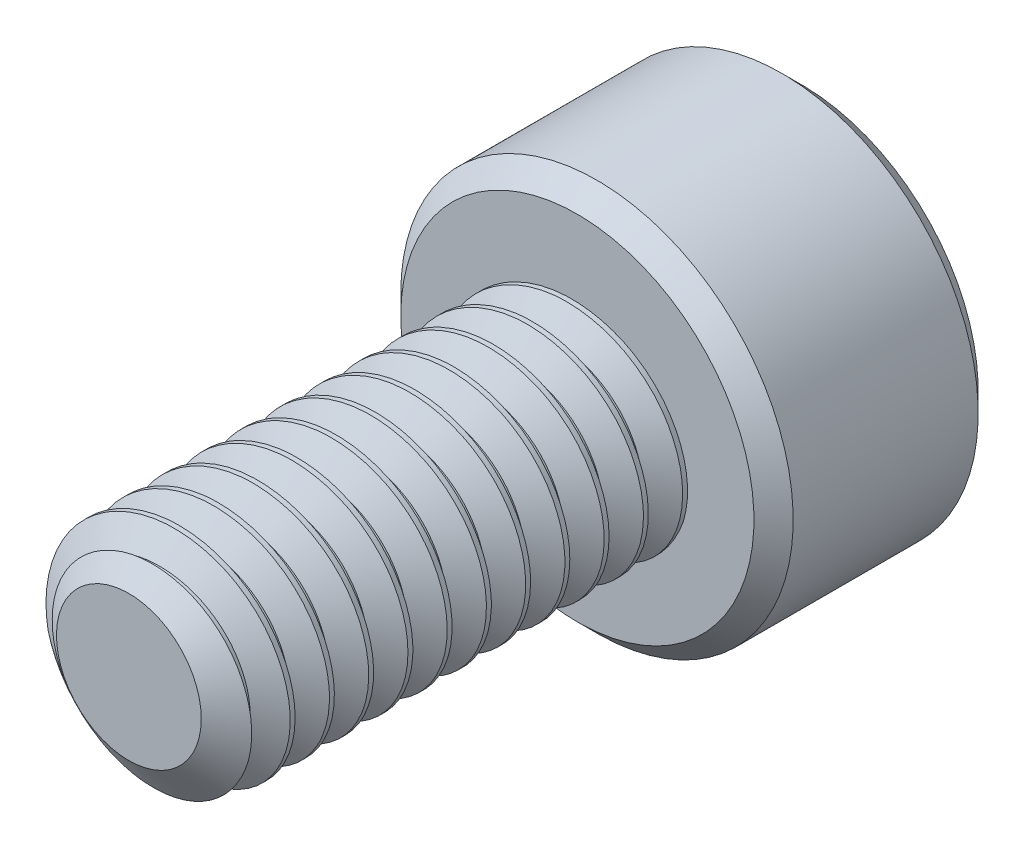
from build123d import *

# Parameters (mm, degrees)
SKETCH1_R          = 2
EXTRUDE1_DEPTH     = 8
CUT_SWEEP1_PITCH   = 0.7
SKETCH6_R          = 3.5
EXTRUDE2_DEPTH     = 4
CUT_EXTRUDE1_DEPTH = 2.25
CHAMFER1_SIZE      = 0.35


with BuildPart() as part:
    # Sketch1 → Extrude1 (new body)
    with BuildSketch(Plane.XY):
        Circle(SKETCH1_R)
    extrude(amount=-EXTRUDE1_DEPTH)

    # Cut-Sweep1: the profile of Sketch3 profile screwed along a right-hand helix of 12.428571 turns, 6 arcs to a turn; built about Z, then put on its axis
    cut_sweep1_z = Axis((0, 0, 0), (0, 0, 1))
    cut_sweep1_corners = [(2.0003, 0, -0.612673205), (1.545336663, 0, -0.35), (1.545336663, 0, -0.2625), (2.0003, 0, 0.000173205)]
    with BuildLine(mode=Mode.PRIVATE) as cut_sweep1_profile:
        Line(cut_sweep1_corners[0], cut_sweep1_corners[1])
        Line(cut_sweep1_corners[1], cut_sweep1_corners[2])
        Line(cut_sweep1_corners[2], cut_sweep1_corners[3])
        Line(cut_sweep1_corners[3], cut_sweep1_corners[0])
    cut_sweep1_cap = Face(cut_sweep1_profile.wire())
    cut_sweep1_turn_angles = [0, 30, 60, 90, 120, 150, 180, 210, 240, 270, 300, 330, 360]
    cut_sweep1_turn_weights = [1, 0.8660254037844387, 1, 0.8660254037844387, 1, 0.8660254037844387, 1, 0.8660254037844387, 1, 0.8660254037844387, 1, 0.8660254037844387, 1]
    cut_sweep1_turn_rails = [Edge.make_bspline([Vector(p[0], p[1], 0).rotate(cut_sweep1_z, cut_sweep1_turn_angles[k]) / cut_sweep1_turn_weights[k] + Vector(0, 0, p[2] + CUT_SWEEP1_PITCH * cut_sweep1_turn_angles[k] / 360) for k in range(13)], [0, 0, 0, 1, 1, 2, 2, 3, 3, 4, 4, 5, 5, 6, 6, 6], 2, cut_sweep1_turn_weights) for p in cut_sweep1_corners]
    cut_sweep1_turn_sides = [Face.make_surface_from_curves(cut_sweep1_turn_rails[p[0]], cut_sweep1_turn_rails[p[1]]) for p in [(0, 1), (1, 2), (2, 3), (3, 0)]]
    cut_sweep1_last_angles = [4320, 4350, 4380, 4410, 4440, 4457.142857143, 4474.285714286]
    cut_sweep1_last_weights = [1, 0.8660254037844387, 1, 0.8660254037844387, 1, 0.9555728057861561, 1]
    cut_sweep1_last_rails = [Edge.make_bspline([Vector(p[0], p[1], 0).rotate(cut_sweep1_z, cut_sweep1_last_angles[k]) / cut_sweep1_last_weights[k] + Vector(0, 0, p[2] + CUT_SWEEP1_PITCH * cut_sweep1_last_angles[k] / 360) for k in range(7)], [0, 0, 0, 1, 1, 2, 2, 3, 3, 3], 2, cut_sweep1_last_weights) for p in cut_sweep1_corners]
    cut_sweep1_last_sides = [Face.make_surface_from_curves(cut_sweep1_last_rails[p[0]], cut_sweep1_last_rails[p[1]]) for p in [(0, 1), (1, 2), (2, 3), (3, 0)]]
    cut_sweep1 = Plane(origin=(0, 0, 0), x_dir=(0, 1, 0), z_dir=(0, 0, -1)) * Solid(Shell([*[p.moved(Location((0, 0, CUT_SWEEP1_PITCH * i))) for i in range(12) for p in cut_sweep1_turn_sides], *cut_sweep1_last_sides, cut_sweep1_cap, cut_sweep1_cap.rotate(cut_sweep1_z, 4474.285714286).moved(Location((0, 0, CUT_SWEEP1_PITCH * 4474.285714286 / 360)))]))
    add(cut_sweep1, mode=Mode.SUBTRACT)

    # Sketch4 → Cut-Revolve1 (revolve, cut)
    with BuildSketch(Plane(origin=(0, 0, 0), x_dir=(0, 0, -1), z_dir=(1, 0, 0)), mode=Mode.PRIVATE) as cut_revolve1_sk:
        Polygon((0.496211411, 2), (0, 1.291336663), (0, 2), align=None)
    revolve(cut_revolve1_sk.sketch.rotate(Axis((0, 0, 0), (0, 0, -1)), 271.401126896), axis=Axis((0, 0, 0), (0, 0, -1)), mode=Mode.SUBTRACT)

    # Sketch6 → Extrude2 (add)
    with BuildSketch(Plane(origin=(0, 0, -8), x_dir=(-1, 0, 0), z_dir=(0, 0, -1))):
        Circle(SKETCH6_R)
    extrude(amount=EXTRUDE2_DEPTH)

    # Sketch7 → Cut-Extrude1 (cut)
    with BuildSketch(Plane(origin=(0, 0, -12), x_dir=(-1, 0, 0), z_dir=(0, 0, -1))):
        Polygon((0, 1.732050808), (-1.5, 0.866025404), (-1.5, -0.866025404), (0, -1.732050808), (1.5, -0.866025404), (1.5, 0.866025404), align=None)
    extrude(amount=-CUT_EXTRUDE1_DEPTH, mode=Mode.SUBTRACT)

    # Cut-Extrude2 cone 1 section (through the dimple's axis) → Cut-Extrude2 (revolve, cut)
    with BuildSketch(Plane(origin=(0, 0, -12), x_dir=(0, 1, 0), z_dir=(1, 0, 0))):
        Polygon((0, 0), (1.732050808, 0), (0, 1.732050808), align=None)
    revolve(axis=Axis((0, 0, -12), (0, 0, 1)), mode=Mode.SUBTRACT)

    # Chamfer1
    chamfer1_edges = [part.edges().sort_by_distance(p)[0] for p in [
        (3.5, 0, -8),
        (3.5, 0, -12),
    ]]
    chamfer(chamfer1_edges, length=CHAMFER1_SIZE)


solid = part.part
